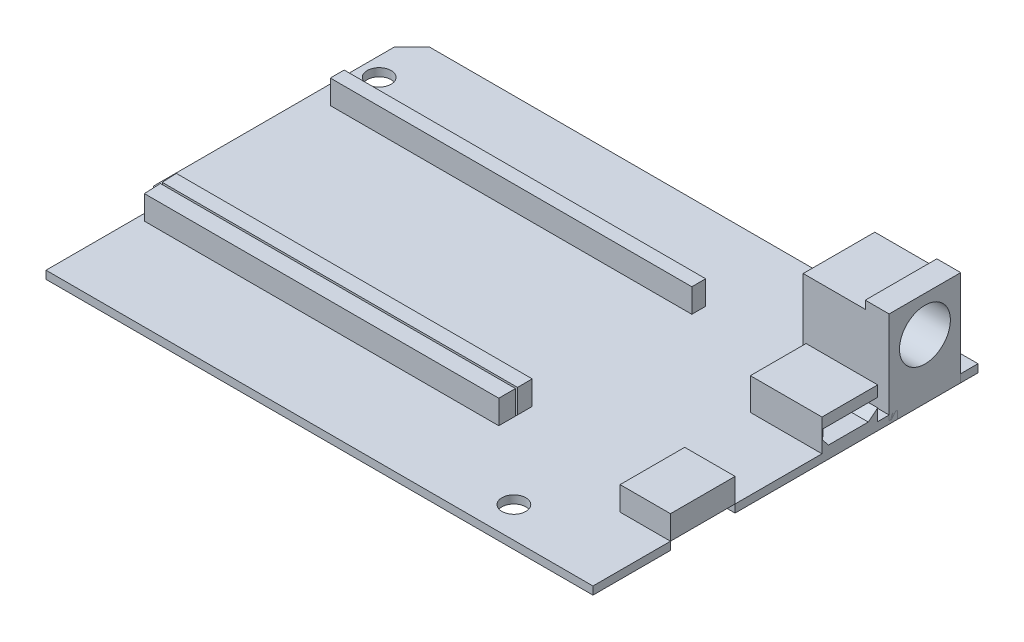
from build123d import *

# Parameters (mm, degrees)
CROQUIS2_R                   = 1.5
CROQUIS2_W                   = 45.430226109
CROQUIS2_H                   = 1.74059968
SALIENTE_EXTRUIR2_DEPTH      = 1
SALIENTE_EXTRUIR5_DEPTH      = 11
SALIENTE_EXTRUIR5_DEPTH_BACK = 1
CROQUIS3_W                   = 10.8
CROQUIS3_H                   = 9
CROQUIS4_R                   = 3.2
CORTAR_EXTRUIR1_DEPTH        = 5
CROQUIS5_W                   = 7.8
CROQUIS5_H                   = 9
CORTAR_EXTRUIR2_DEPTH        = 1
SALIENTE_EXTRUIR6_DEPTH      = 4
SALIENTE_EXTRUIR6_DEPTH_BACK = 1
CROQUIS6_W                   = 9
CROQUIS6_H                   = 7
CORTAR_EXTRUIR3_DEPTH        = 4
CROQUIS8_W                   = 6.329954447
CROQUIS8_H                   = 8.118219625
SALIENTE_EXTRUIR7_DEPTH      = 3
SALIENTE_EXTRUIR8_DEPTH      = 3
SALIENTE_EXTRUIR8_DEPTH_BACK = 1
CROQUIS9_W                   = 45.430226109
CROQUIS9_H                   = 1.74059968


with BuildPart() as part:
    # Croquis2 → Saliente-Extruir2 (new body)
    with BuildSketch(Plane(origin=(0, 0, 0), x_dir=(1, 0, 0), z_dir=(0, 1, 0))):
        Polygon((-114.205989543, 45.350793669), (-183.177349022, 45.350793669), (-185.346387965, 43.181754726), (-185.346387965, 12.898278129), (-182.944348972, 10.496239137), (-182.944348972, 8.483369714), (-182.944348972, -3.035939151), (-114.205989543, -3.035939151), (-114.205989543, 6.703917116), (-120.53594399, 6.703917116), (-120.53594399, 14.822136741), (-114.205989543, 14.822136741), (-114.205989543, 25.822407586), (-118.635147944, 25.822407586), (-118.635147944, 32.742977756), (-114.205989543, 32.742977756), (-114.205989543, 35.225683913), (-125.100189967, 35.225683913), (-125.100189967, 43.181754726), (-114.205989543, 43.181754726), align=None)
        with Locations((-183.186680014, 14.169663208)):
            Circle(CROQUIS2_R, mode=Mode.SUBTRACT)
        Polygon((-182.192965891, 10.586368559), (-182.289134654, 12.689367405), (-137.563892409, 12.689367405), (-137.563892409, 10.586368559), (-137.563892409, 8.483369714), (-182.096797127, 8.483369714), align=None, mode=Mode.SUBTRACT)
        with Locations((-128.03733826, 0.855831955)):
            Circle(CROQUIS2_R, mode=Mode.SUBTRACT)
        with Locations((-182.994118518, 38.885795922)):
            Circle(CROQUIS2_R, mode=Mode.SUBTRACT)
        with Locations((-160.279005464, 33.613277596)):
            Rectangle(CROQUIS2_W, CROQUIS2_H, mode=Mode.SUBTRACT)
        with Locations((-127.070714237, 43.683877878)):
            Circle(CROQUIS2_R, mode=Mode.SUBTRACT)
    extrude(amount=SALIENTE_EXTRUIR2_DEPTH)

    # Croquis6 → Saliente-Extruir6 (add, two sides: drawn at the far end of the back side and taken through both)
    with BuildSketch(Plane(origin=(0, 1, 0), x_dir=(1, 0, 0), z_dir=(0, 1, 0)).offset(-SALIENTE_EXTRUIR6_DEPTH_BACK)):
        with Locations((-118.705989543, 29.242977756)):
            Rectangle(CROQUIS6_W, CROQUIS6_H)
    extrude(amount=SALIENTE_EXTRUIR6_DEPTH + SALIENTE_EXTRUIR6_DEPTH_BACK)

    # Croquis7 → Cortar-Extruir3 (cut)
    with BuildSketch(Plane(origin=(-114.205989543, 0, 0), x_dir=(0, 0, -1), z_dir=(1, 0, 0))):
        Polygon((25.866485873, 3.643487769), (32.752542358, 3.643487769), (32.752542358, 2.505548171), (31.561801116, 1.543487769), (26.561801116, 1.543487769), (25.830702469, 2.448367867), align=None)
    extrude(amount=-CORTAR_EXTRUIR3_DEPTH, mode=Mode.SUBTRACT)

    # Croquis9 → Saliente-Extruir8 (add, two sides: drawn at the far end of the back side and taken through both)
    with BuildSketch(Plane(origin=(0, 1, 0), x_dir=(1, 0, 0), z_dir=(0, 1, 0)).offset(-SALIENTE_EXTRUIR8_DEPTH_BACK)):
        with Locations((-160.279005464, 33.613277596)):
            Rectangle(CROQUIS9_W, CROQUIS9_H)
        Polygon((-137.563892409, 10.833630724), (-137.563892409, 12.689367405), (-182.289134654, 12.689367405), (-182.204273028, 10.833630724), align=None)
        Polygon((-137.563892409, 8.483369714), (-137.563892409, 10.586368559), (-182.192965891, 10.586368559), (-182.096797127, 8.483369714), align=None)
    extrude(amount=SALIENTE_EXTRUIR8_DEPTH + SALIENTE_EXTRUIR8_DEPTH_BACK)


with BuildPart() as body_2:
    # Croquis3 → Saliente-Extruir5 (new, two sides: drawn at the far end of the back side and taken through both)
    with BuildSketch(Plane(origin=(0, 1, 0), x_dir=(1, 0, 0), z_dir=(0, 1, 0)).offset(-SALIENTE_EXTRUIR5_DEPTH_BACK)):
        with Locations((-119.605989543, 38.681754726)):
            Rectangle(CROQUIS3_W, CROQUIS3_H)
    extrude(amount=SALIENTE_EXTRUIR5_DEPTH + SALIENTE_EXTRUIR5_DEPTH_BACK)

    # Croquis4 → Cortar-Extruir1 (cut)
    with BuildSketch(Plane(origin=(-114.205989543, 0, 0), x_dir=(0, 0, -1), z_dir=(1, 0, 0))):
        with Locations((38.681754726, 7.5)):
            Circle(CROQUIS4_R)
    extrude(amount=-CORTAR_EXTRUIR1_DEPTH, mode=Mode.SUBTRACT)

    # Croquis5 → Cortar-Extruir2 (cut)
    with BuildSketch(Plane(origin=(0, 12, 0), x_dir=(1, 0, 0), z_dir=(0, 1, 0))):
        with Locations((-121.105989543, 38.681754726)):
            Rectangle(CROQUIS5_W, CROQUIS5_H)
    extrude(amount=-CORTAR_EXTRUIR2_DEPTH, mode=Mode.SUBTRACT)


with BuildPart() as body_3:
    # Croquis8 → Saliente-Extruir7 (new body)
    with BuildSketch(Plane(origin=(0, 1, 0), x_dir=(1, 0, 0), z_dir=(0, 1, 0))):
        with Locations((-117.370966767, 10.763026929)):
            Rectangle(CROQUIS8_W, CROQUIS8_H)
    extrude(amount=SALIENTE_EXTRUIR7_DEPTH)


solid = Compound([part.part, body_2.part, body_3.part])
